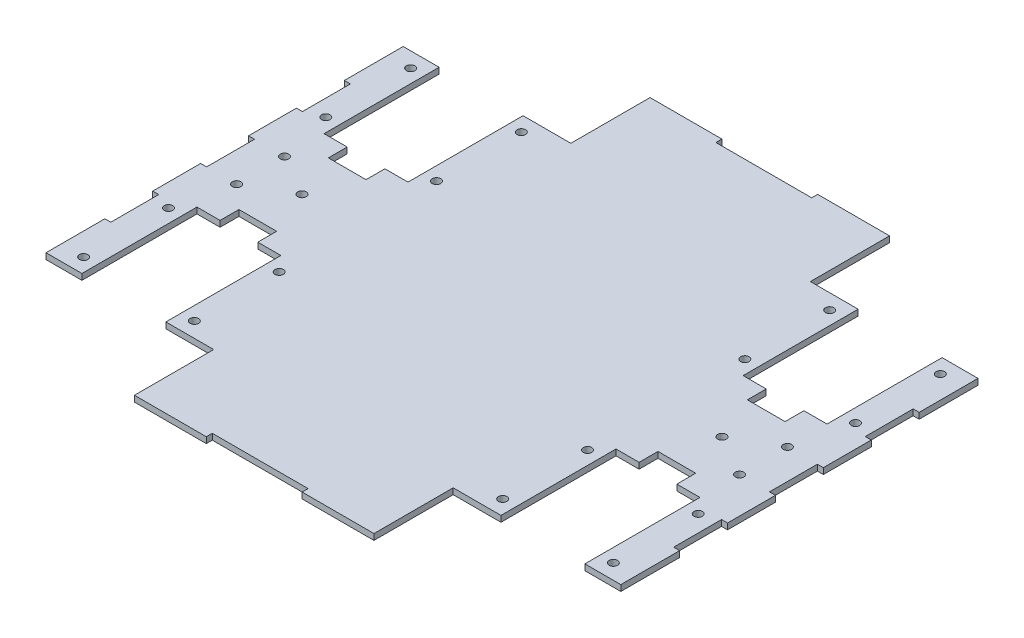
from build123d import *

# Parameters (mm, degrees)
SKETCH1_R           = 2.25
BOSS_EXTRUDE1_DEPTH = 3.175


with BuildPart() as part:
    # Sketch1 → Boss-Extrude1 (new body)
    with BuildSketch(Plane(origin=(0, 0, 0), x_dir=(1, 0, 0), z_dir=(0, 1, 0))):
        Polygon((152.4, 63.5), (152.4, 94.7), (133.35, 94.7), (133.35, 33.7), (121.0988, 33.7), (121.0988, 23.7), (101.0988, 23.7), (101.0988, 33.7), (88.8476, 33.7), (88.8476, 94.7), (63.5, 94.7), (63.5, 136.7), (25.4, 136.7), (25.4, 133.525), (-25.4, 133.525), (-25.4, 136.7), (-63.5, 136.7), (-63.5, 94.7), (-88.8476, 94.7), (-88.8476, 33.7), (-101.0988, 33.7), (-101.0988, 23.7), (-121.0988, 23.7), (-121.0988, 33.7), (-133.35, 33.7), (-133.35, 94.7), (-152.4, 94.7), (-152.4, 63.5), (-149.225, 63.5), (-149.225, 38.1), (-152.4, 38.1), (-152.4, 12.7), (-149.225, 12.7), (-149.225, -12.7), (-152.4, -12.7), (-152.4, -38.1), (-149.225, -38.1), (-149.225, -63.5), (-152.4, -63.5), (-152.4, -94.7), (-133.35, -94.7), (-133.35, -33.7), (-121.0988, -33.7), (-121.0988, -23.7), (-101.0988, -23.7), (-101.0988, -33.7), (-88.8476, -33.7), (-88.8476, -94.7), (-63.5, -94.7), (-63.5, -136.7), (-25.4, -136.7), (-25.4, -133.525), (25.4, -133.525), (25.4, -136.7), (63.5, -136.7), (63.5, -94.7), (88.8476, -94.7), (88.8476, -33.7), (101.0988, -33.7), (101.0988, -23.7), (121.0988, -23.7), (121.0988, -33.7), (133.35, -33.7), (133.35, -94.7), (152.4, -94.7), (152.4, -63.5), (149.225, -63.5), (149.225, -38.1), (152.4, -38.1), (152.4, -12.7), (149.225, -12.7), (149.225, 12.7), (152.4, 12.7), (152.4, 38.1), (149.225, 38.1), (149.225, 63.5), align=None)
        with Locations((-140.4411, -86.7)):
            Circle(SKETCH1_R, mode=Mode.SUBTRACT)
        with Locations((-81.7565, -86.7)):
            Circle(SKETCH1_R, mode=Mode.SUBTRACT)
        with Locations((-140.4411, -41.7)):
            Circle(SKETCH1_R, mode=Mode.SUBTRACT)
        with Locations((-81.7565, -41.7)):
            Circle(SKETCH1_R, mode=Mode.SUBTRACT)
        with Locations((-133.35, -12.7)):
            Circle(SKETCH1_R, mode=Mode.SUBTRACT)
        with Locations((81.7565, -86.7)):
            Circle(SKETCH1_R, mode=Mode.SUBTRACT)
        with Locations((140.4411, -86.7)):
            Circle(SKETCH1_R, mode=Mode.SUBTRACT)
        with Locations((81.7565, -41.7)):
            Circle(SKETCH1_R, mode=Mode.SUBTRACT)
        with Locations((140.4411, -41.7)):
            Circle(SKETCH1_R, mode=Mode.SUBTRACT)
        with Locations((133.35, -12.7)):
            Circle(SKETCH1_R, mode=Mode.SUBTRACT)
        with Locations((-133.35, 12.7)):
            Circle(SKETCH1_R, mode=Mode.SUBTRACT)
        with Locations((-111.352954744, 0)):
            Circle(SKETCH1_R, mode=Mode.SUBTRACT)
        with Locations((-140.4411, 41.7)):
            Circle(SKETCH1_R, mode=Mode.SUBTRACT)
        with Locations((-81.7565, 41.7)):
            Circle(SKETCH1_R, mode=Mode.SUBTRACT)
        with Locations((-140.4411, 86.7)):
            Circle(SKETCH1_R, mode=Mode.SUBTRACT)
        with Locations((-81.7565, 86.7)):
            Circle(SKETCH1_R, mode=Mode.SUBTRACT)
        with Locations((111.352954744, 0)):
            Circle(SKETCH1_R, mode=Mode.SUBTRACT)
        with Locations((133.35, 12.7)):
            Circle(SKETCH1_R, mode=Mode.SUBTRACT)
        with Locations((81.7565, 41.7)):
            Circle(SKETCH1_R, mode=Mode.SUBTRACT)
        with Locations((140.4411, 41.7)):
            Circle(SKETCH1_R, mode=Mode.SUBTRACT)
        with Locations((81.7565, 86.7)):
            Circle(SKETCH1_R, mode=Mode.SUBTRACT)
        with Locations((140.4411, 86.7)):
            Circle(SKETCH1_R, mode=Mode.SUBTRACT)
    extrude(amount=BOSS_EXTRUDE1_DEPTH)


solid = part.part
